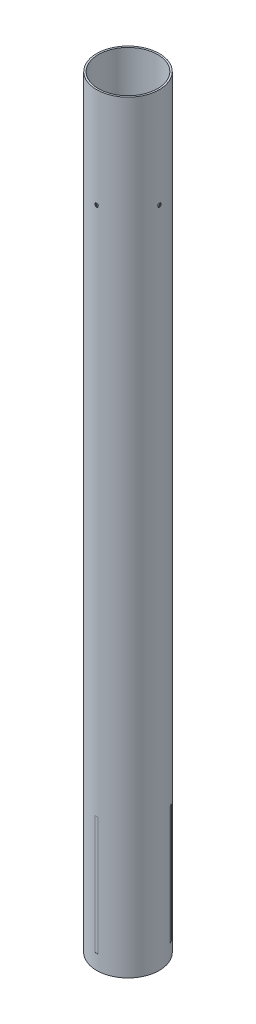
from build123d import *

# Parameters (mm, degrees)
SKETCH1_R               = 53.721
SKETCH1_R_2             = 50.8
TUBE_EXTRUSION_DEPTH    = 1308.1
ENGINE_BLOCK_HOLE_REACH = 1315.604
SKETCH2_R               = 1.6383
CIRPATTERN1_COUNT       = 4
SKETCH3_W               = 5.334
SKETCH3_H               = 203.2
FIN_SLOTS_DEPTH         = 0.254
CIRPATTERN2_COUNT       = 3
SKETCH4_R               = 3.175
CUT_EXTRUDE1_DEPTH      = 1.27
CIRPATTERN3_COUNT       = 4


with BuildPart() as part:
    # Sketch1 → Tube Extrusion (new body)
    with BuildSketch(Plane(origin=(0, 0, 0), x_dir=(1, 0, 0), z_dir=(0, 1, 0))):
        Circle(SKETCH1_R)
        Circle(SKETCH1_R_2, mode=Mode.SUBTRACT)
    extrude(amount=TUBE_EXTRUSION_DEPTH)

    # Sketch2 → Engine Block Hole (cut, up to next)
    with BuildSketch(Plane.XY.offset(53.721), mode=Mode.PRIVATE) as engine_block_hole_sk1:
        with Locations((0, 1136.65)):
            Circle(SKETCH2_R)
    engine_block_hole_tool1 = extrude(engine_block_hole_sk1.sketch, amount=-ENGINE_BLOCK_HOLE_REACH, mode=Mode.PRIVATE) & part.part
    engine_block_hole = engine_block_hole_tool1.solids().sort_by_distance((0, 1136.65, 53.721))[0]
    add(engine_block_hole, mode=Mode.SUBTRACT)

    # CirPattern1: Engine Block Hole ×4 about axis
    cirpattern1_axis = Axis((0, 1308.1, 0), (0, -1, 0))
    for i in range(1, CIRPATTERN1_COUNT):
        add(engine_block_hole.rotate(cirpattern1_axis, i * 360 / CIRPATTERN1_COUNT), mode=Mode.SUBTRACT)

    # Sketch3 → Fin Slots (cut)
    with BuildSketch(Plane.XY.offset(53.721)):
        with Locations((0, 127)):
            Rectangle(SKETCH3_W, SKETCH3_H)
    fin_slots = extrude(amount=-FIN_SLOTS_DEPTH, mode=Mode.SUBTRACT)

    # CirPattern2: Fin Slots ×3 about axis
    cirpattern2_axis = Axis((0, 1308.1, 0), (0, -1, 0))
    for i in range(1, CIRPATTERN2_COUNT):
        add(fin_slots.rotate(cirpattern2_axis, i * 360 / CIRPATTERN2_COUNT), mode=Mode.SUBTRACT)

    # Sketch4 → Cut-Extrude1 (cut)
    with BuildSketch(Plane.XY.offset(53.721)):
        with Locations((0, 1136.65)):
            Circle(SKETCH4_R)
    cut_extrude1 = extrude(amount=-CUT_EXTRUDE1_DEPTH, mode=Mode.SUBTRACT)

    # CirPattern3: Cut-Extrude1 ×4 about axis
    cirpattern3_axis = Axis((0, 1308.1, 0), (0, -1, 0))
    for i in range(1, CIRPATTERN3_COUNT):
        add(cut_extrude1.rotate(cirpattern3_axis, i * 360 / CIRPATTERN3_COUNT), mode=Mode.SUBTRACT)


solid = part.part
